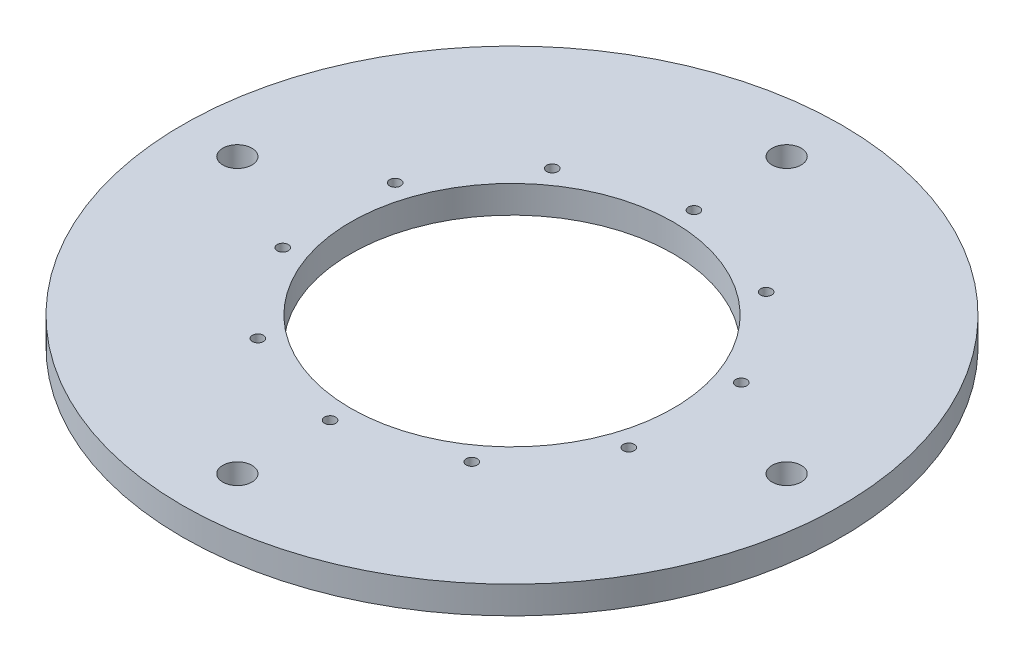
from build123d import *

# Parameters (mm, degrees)
SKETCH1_R                           = 152.4
SKETCH1_R_2                         = 74.6125
THRUSTPLATE_TC3_DEPTH               = 12.7
UNDEF_CLEARANCE_THRUSTPLATE_D       = 13.49248
CLEARANCE_THRUSTPLATE_PATTERN_COUNT = 4
F_10_CLEARANCE_HOLE1_D              = 5.1054
CIRPATTERN1_COUNT                   = 10


with BuildPart() as part:
    # Sketch1 → ThrustPlate_TC3 (new body)
    with BuildSketch(Plane(origin=(0, 0, 0), x_dir=(1, 0, 0), z_dir=(0, 1, 0))):
        Circle(SKETCH1_R)
        Circle(SKETCH1_R_2, mode=Mode.SUBTRACT)
    extrude(amount=-THRUSTPLATE_TC3_DEPTH)

    # UNDEF_Clearance_ThrustPlate (through all)
    with Locations(Plane(origin=(0, 0, 0), x_dir=(1, 0, 0), z_dir=(0, 1, 0))):
        with Locations((0, 127)):
            undef_clearance_thrustplate = Hole(UNDEF_CLEARANCE_THRUSTPLATE_D / 2)

    # Clearance_ThrustPlate_Pattern: UNDEF_Clearance_ThrustPlate ×4 about axis
    clearance_thrustplate_pattern_axis = Axis((0, -12.7, 0), (0, 1, 0))
    for i in range(1, CLEARANCE_THRUSTPLATE_PATTERN_COUNT):
        add(undef_clearance_thrustplate.rotate(clearance_thrustplate_pattern_axis, i * 360 / CLEARANCE_THRUSTPLATE_PATTERN_COUNT), mode=Mode.SUBTRACT)

    # #10 Clearance Hole1 (through all)
    with Locations(Plane(origin=(0, 0, 0), x_dir=(1, 0, 0), z_dir=(0, 1, 0))):
        with Locations((0, 84.1375)):
            f_10_clearance_hole1 = Hole(F_10_CLEARANCE_HOLE1_D / 2)

    # CirPattern1: #10 Clearance Hole1 ×10 about axis
    cirpattern1_axis = Axis((0, -12.7, 0), (0, 1, 0))
    for i in range(1, CIRPATTERN1_COUNT):
        add(f_10_clearance_hole1.rotate(cirpattern1_axis, i * 360 / CIRPATTERN1_COUNT), mode=Mode.SUBTRACT)


solid = part.part
